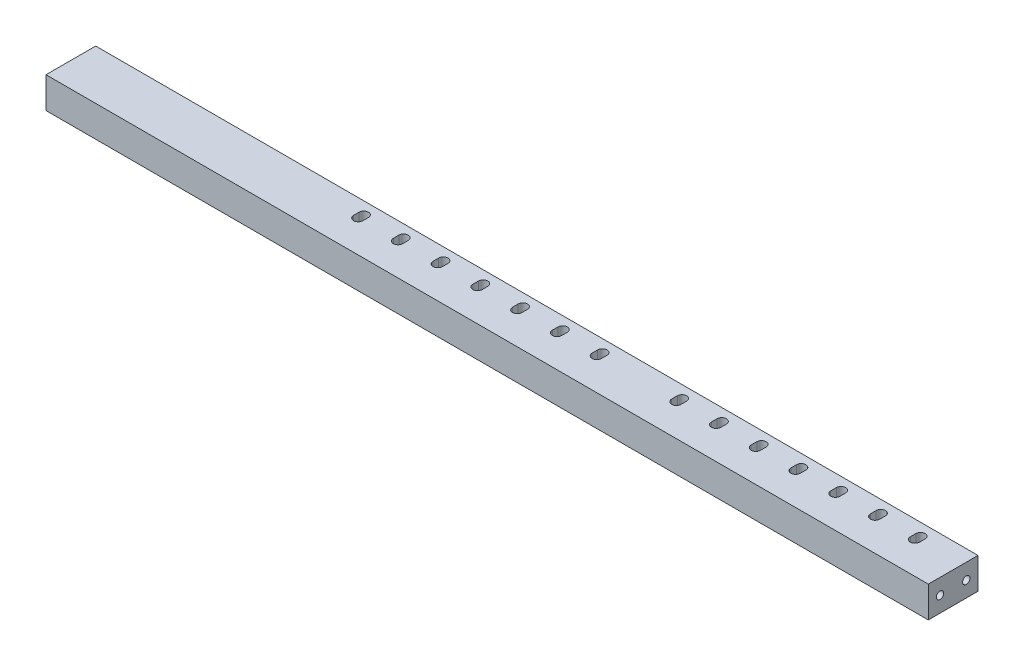
from build123d import *

# Parameters (mm, degrees)
SKETCH1_W                      = 25.4
SKETCH1_H                      = 15.875
BOSS_EXTRUDE1_DEPTH            = 450.85
TAP_DRILL_FOR_10_24_TAP1_D     = 3.7973
TAP_DRILL_FOR_10_24_TAP1_DEPTH = 20.701
TAP_DRILL_FOR_10_24_TAP1_TIP   = 1.140824014
TAP_DRILL_FOR_10_24_TAP2_D     = 3.7973
TAP_DRILL_FOR_10_24_TAP2_DEPTH = 19.05
TAP_DRILL_FOR_10_24_TAP2_TIP   = 1.140824014
F_10_CLEARANCE_SLOT2_DEPTH     = 15.875


# Read off the part's stored shape, not the designer's step: #10 Clearance Slot2
with BuildPart() as part:
    # Sketch1 → Boss-Extrude1 (new body)
    with BuildSketch(Plane(origin=(0, 0, 0), x_dir=(0, 0, -1), z_dir=(1, 0, 0))):
        with Locations((12.7, 7.9375)):
            Rectangle(SKETCH1_W, SKETCH1_H)
    extrude(amount=BOSS_EXTRUDE1_DEPTH)

    # Tap Drill for #10-24 Tap1
    with Locations(Plane.ZY):
        with Locations((-6, 7.9375), (-19.4, 7.9375)):
            Hole(TAP_DRILL_FOR_10_24_TAP1_D / 2, depth=TAP_DRILL_FOR_10_24_TAP1_DEPTH)
            with Locations((0, 0, -(TAP_DRILL_FOR_10_24_TAP1_DEPTH + TAP_DRILL_FOR_10_24_TAP1_TIP / 2))):  # 118° drill point
                Cone(0, TAP_DRILL_FOR_10_24_TAP1_D / 2, TAP_DRILL_FOR_10_24_TAP1_TIP, mode=Mode.SUBTRACT)

    # Tap Drill for #10-24 Tap2
    with Locations(Plane(origin=(450.85, 0, 0), x_dir=(0, 0, -1), z_dir=(1, 0, 0))):
        with Locations((6, 7.9375), (19.4, 7.9375)):
            Hole(TAP_DRILL_FOR_10_24_TAP2_D / 2, depth=TAP_DRILL_FOR_10_24_TAP2_DEPTH)
            with Locations((0, 0, -(TAP_DRILL_FOR_10_24_TAP2_DEPTH + TAP_DRILL_FOR_10_24_TAP2_TIP / 2))):  # 118° drill point
                Cone(0, TAP_DRILL_FOR_10_24_TAP2_D / 2, TAP_DRILL_FOR_10_24_TAP2_TIP, mode=Mode.SUBTRACT)

    # #10 Clearance Slot2 outline → #10 Clearance Slot2 (cut)
    with BuildSketch(Plane(origin=(0, 0, 0), x_dir=(1, 0, 0), z_dir=(0, 1, 0))):
        with BuildLine():
            Line((145.57375, 16.35125), (145.57375, 19.20875))
            ThreePointArc((145.57375, 19.20875), (143.1925, 21.59), (140.81125, 19.20875))
            Line((140.81125, 19.20875), (140.81125, 16.35125))
            ThreePointArc((140.81125, 16.35125), (143.1925, 13.97), (145.57375, 16.35125))
        make_face()
        with BuildLine():
            Line((165.89375, 16.35125), (165.89375, 19.20875))
            ThreePointArc((165.89375, 19.20875), (163.5125, 21.59), (161.13125, 19.20875))
            Line((161.13125, 19.20875), (161.13125, 16.35125))
            ThreePointArc((161.13125, 16.35125), (163.5125, 13.97), (165.89375, 16.35125))
        make_face()
        with BuildLine():
            Line((186.21375, 16.35125), (186.21375, 19.20875))
            ThreePointArc((186.21375, 19.20875), (183.8325, 21.59), (181.45125, 19.20875))
            Line((181.45125, 19.20875), (181.45125, 16.35125))
            ThreePointArc((181.45125, 16.35125), (183.8325, 13.97), (186.21375, 16.35125))
        make_face()
        with BuildLine():
            Line((206.53375, 16.35125), (206.53375, 19.20875))
            ThreePointArc((206.53375, 19.20875), (204.1525, 21.59), (201.77125, 19.20875))
            Line((201.77125, 19.20875), (201.77125, 16.35125))
            ThreePointArc((201.77125, 16.35125), (204.1525, 13.97), (206.53375, 16.35125))
        make_face()
        with BuildLine():
            Line((226.85375, 16.35125), (226.85375, 19.20875))
            ThreePointArc((226.85375, 19.20875), (224.4725, 21.59), (222.09125, 19.20875))
            Line((222.09125, 19.20875), (222.09125, 16.35125))
            ThreePointArc((222.09125, 16.35125), (224.4725, 13.97), (226.85375, 16.35125))
        make_face()
        with BuildLine():
            Line((247.17375, 16.35125), (247.17375, 19.20875))
            ThreePointArc((247.17375, 19.20875), (244.7925, 21.59), (242.41125, 19.20875))
            Line((242.41125, 19.20875), (242.41125, 16.35125))
            ThreePointArc((242.41125, 16.35125), (244.7925, 13.97), (247.17375, 16.35125))
        make_face()
        with BuildLine():
            Line((267.49375, 16.35125), (267.49375, 19.20875))
            ThreePointArc((267.49375, 19.20875), (265.1125, 21.59), (262.73125, 19.20875))
            Line((262.73125, 19.20875), (262.73125, 16.35125))
            ThreePointArc((262.73125, 16.35125), (265.1125, 13.97), (267.49375, 16.35125))
        make_face()
        with BuildLine():
            Line((308.13375, 16.35125), (308.13375, 19.20875))
            ThreePointArc((308.13375, 19.20875), (305.7525, 21.59), (303.37125, 19.20875))
            Line((303.37125, 19.20875), (303.37125, 16.35125))
            ThreePointArc((303.37125, 16.35125), (305.7525, 13.97), (308.13375, 16.35125))
        make_face()
        with BuildLine():
            Line((328.45375, 16.35125), (328.45375, 19.20875))
            ThreePointArc((328.45375, 19.20875), (326.0725, 21.59), (323.69125, 19.20875))
            Line((323.69125, 19.20875), (323.69125, 16.35125))
            ThreePointArc((323.69125, 16.35125), (326.0725, 13.97), (328.45375, 16.35125))
        make_face()
        with BuildLine():
            Line((348.77375, 16.35125), (348.77375, 19.20875))
            ThreePointArc((348.77375, 19.20875), (346.3925, 21.59), (344.01125, 19.20875))
            Line((344.01125, 19.20875), (344.01125, 16.35125))
            ThreePointArc((344.01125, 16.35125), (346.3925, 13.97), (348.77375, 16.35125))
        make_face()
        with BuildLine():
            Line((369.09375, 16.35125), (369.09375, 19.20875))
            ThreePointArc((369.09375, 19.20875), (366.7125, 21.59), (364.33125, 19.20875))
            Line((364.33125, 19.20875), (364.33125, 16.35125))
            ThreePointArc((364.33125, 16.35125), (366.7125, 13.97), (369.09375, 16.35125))
        make_face()
        with BuildLine():
            Line((389.41375, 16.35125), (389.41375, 19.20875))
            ThreePointArc((389.41375, 19.20875), (387.0325, 21.59), (384.65125, 19.20875))
            Line((384.65125, 19.20875), (384.65125, 16.35125))
            ThreePointArc((384.65125, 16.35125), (387.0325, 13.97), (389.41375, 16.35125))
        make_face()
        with BuildLine():
            Line((409.73375, 16.35125), (409.73375, 19.20875))
            ThreePointArc((409.73375, 19.20875), (407.3525, 21.59), (404.97125, 19.20875))
            Line((404.97125, 19.20875), (404.97125, 16.35125))
            ThreePointArc((404.97125, 16.35125), (407.3525, 13.97), (409.73375, 16.35125))
        make_face()
        with BuildLine():
            Line((430.05375, 16.35125), (430.05375, 19.20875))
            ThreePointArc((430.05375, 19.20875), (427.6725, 21.59), (425.29125, 19.20875))
            Line((425.29125, 19.20875), (425.29125, 16.35125))
            ThreePointArc((425.29125, 16.35125), (427.6725, 13.97), (430.05375, 16.35125))
        make_face()
    extrude(amount=F_10_CLEARANCE_SLOT2_DEPTH, mode=Mode.SUBTRACT)


solid = part.part
